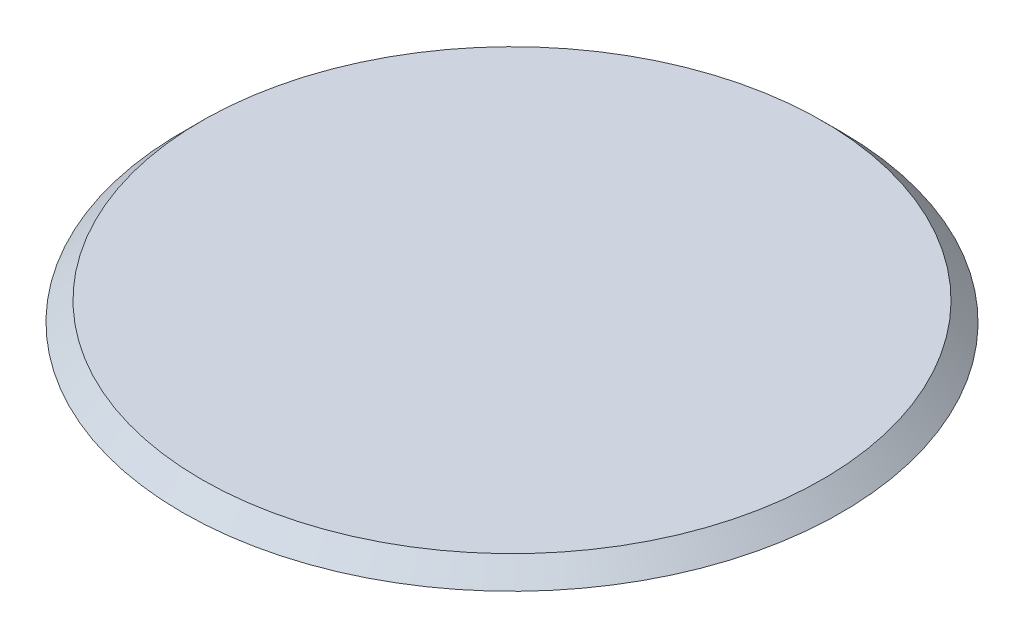
from build123d import *

# Parameters (mm, degrees)
SKETCH1_R           = 3.45
BOSS_EXTRUDE1_DEPTH = 0.2
CHAMFER1_SIZE       = 0.2


with BuildPart() as part:
    # Sketch1 → Boss-Extrude1 (new body)
    with BuildSketch(Plane(origin=(0, 0, 0), x_dir=(1, 0, 0), z_dir=(0, 1, 0))):
        with Locations(Location((0, 0, 0), (0, 0, 270))):
            Circle(SKETCH1_R)
    extrude(amount=BOSS_EXTRUDE1_DEPTH)

    # Chamfer1
    chamfer1_edges = [part.edges().sort_by_distance(p)[0] for p in [
        (0, 0.2, -3.45),
    ]]
    chamfer(chamfer1_edges, length=CHAMFER1_SIZE - 0.0001)  # a hair under: the kernel refuses the full size


solid = part.part
